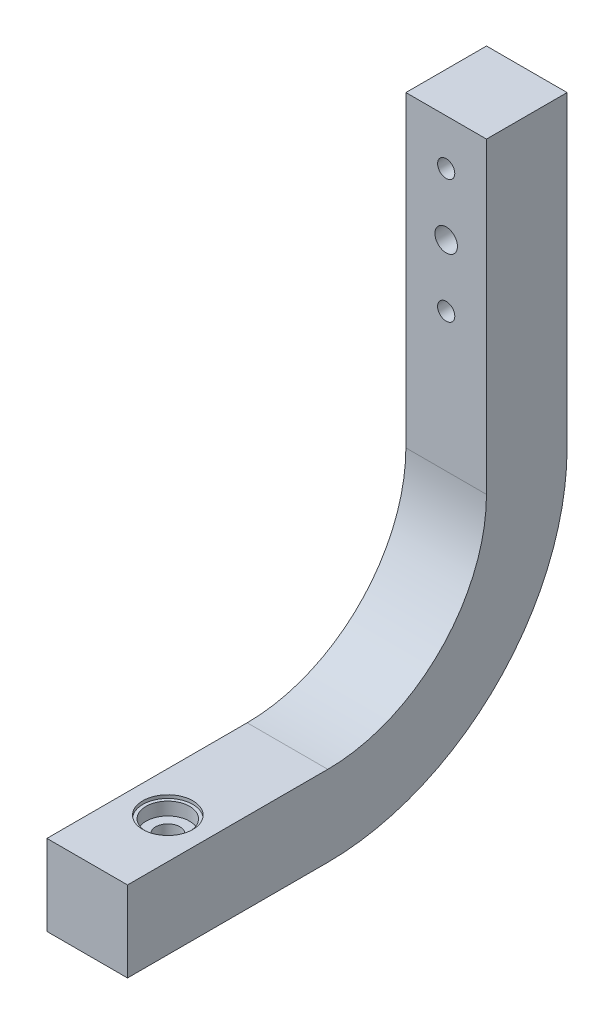
from build123d import *

# Parameters (mm, degrees)
BOSS_EXTRUDE1_DEPTH      = 7.5
BOSS_EXTRUDE1_DEPTH_BACK = 7.5
SKETCH3_R                = 2.25
CUT_EXTRUDE1_DEPTH       = 120.512655858
CUT_EXTRUDE2_DEPTH       = 106.882442604
CUT_EXTRUDE2_DEPTH_BACK  = 106.882442604
SKETCH4_R                = 2.1
SKETCH4_R_2              = 1.6


with BuildPart() as part:
    # Sketch1 → Boss-Extrude1 (new, two sides: drawn at the far end of the back side and taken through both)
    with BuildSketch(Plane(origin=(0, 0, 0), x_dir=(0, 0, -1), z_dir=(1, 0, 0)).offset(-BOSS_EXTRUDE1_DEPTH_BACK)):
        with BuildLine():
            Line((-15, 20), (0, 20))
            Line((0, 20), (0, -37.26819382))
            ThreePointArc((0, -37.26819382), (-13.04440593, -68.76017553), (-44.53638764, -81.80458146))
            Line((-44.53638764, -81.80458146), (-66.80458146, -81.80458146))
            Line((-66.80458146, -81.80458146), (-81.80458146, -81.80458146))
            Line((-81.80458146, -81.80458146), (-81.80458146, -66.80458146))
            Line((-81.80458146, -66.80458146), (-66.80458146, -66.80458146))
            Line((-66.80458146, -66.80458146), (-44.53638764, -66.80458146))
            ThreePointArc((-44.53638764, -66.80458146), (-23.651007648, -58.153573812), (-15, -37.26819382))
            Line((-15, -37.26819382), (-15, 20))
        make_face()
    extrude(amount=BOSS_EXTRUDE1_DEPTH + BOSS_EXTRUDE1_DEPTH_BACK)

    # Sketch3 → Cut-Extrude1 (cut, through all)
    with BuildSketch(Plane(origin=(0, -66.80458146, 0), x_dir=(1, 0, 0), z_dir=(0, 1, 0))):
        with Locations((0, -66.80458146)):
            Circle(SKETCH3_R)
    extrude(amount=-CUT_EXTRUDE1_DEPTH, mode=Mode.SUBTRACT)

    # Sketch4 → Cut-Extrude2 (cut, two sides: drawn at the far end of the back side and taken through both)
    with BuildSketch(Plane.XY.offset(15).offset(-CUT_EXTRUDE2_DEPTH_BACK)):
        Circle(SKETCH4_R)
        with Locations((0, 11.5)):
            Circle(SKETCH4_R_2)
        with Locations((0, -11.5)):
            Circle(SKETCH4_R_2)
    extrude(amount=CUT_EXTRUDE2_DEPTH + CUT_EXTRUDE2_DEPTH_BACK, mode=Mode.SUBTRACT)

    # Sketch5 → Cut-Revolve1 (revolve, cut)
    with BuildSketch(Plane(origin=(0, 0, 0), x_dir=(0, 0, -1), z_dir=(1, 0, 0))):
        Polygon((-62.75458146, -78.80458146), (-62.75458146, -81.20458146), (-62.15458146, -81.20458146), (-62.15458146, -81.80458146), (-66.80458146, -81.80458146), (-66.80458146, -78.80458146), align=None)
        Polygon((-66.80458146, -69.80458146), (-62.75458146, -69.80458146), (-62.75458146, -67.40458146), (-62.15458146, -67.40458146), (-62.15458146, -66.80458146), (-66.80458146, -66.80458146), align=None)
    revolve(axis=Axis((0, -52.168735771, 66.80458146), (0, 1, 0)), mode=Mode.SUBTRACT)


solid = part.part
